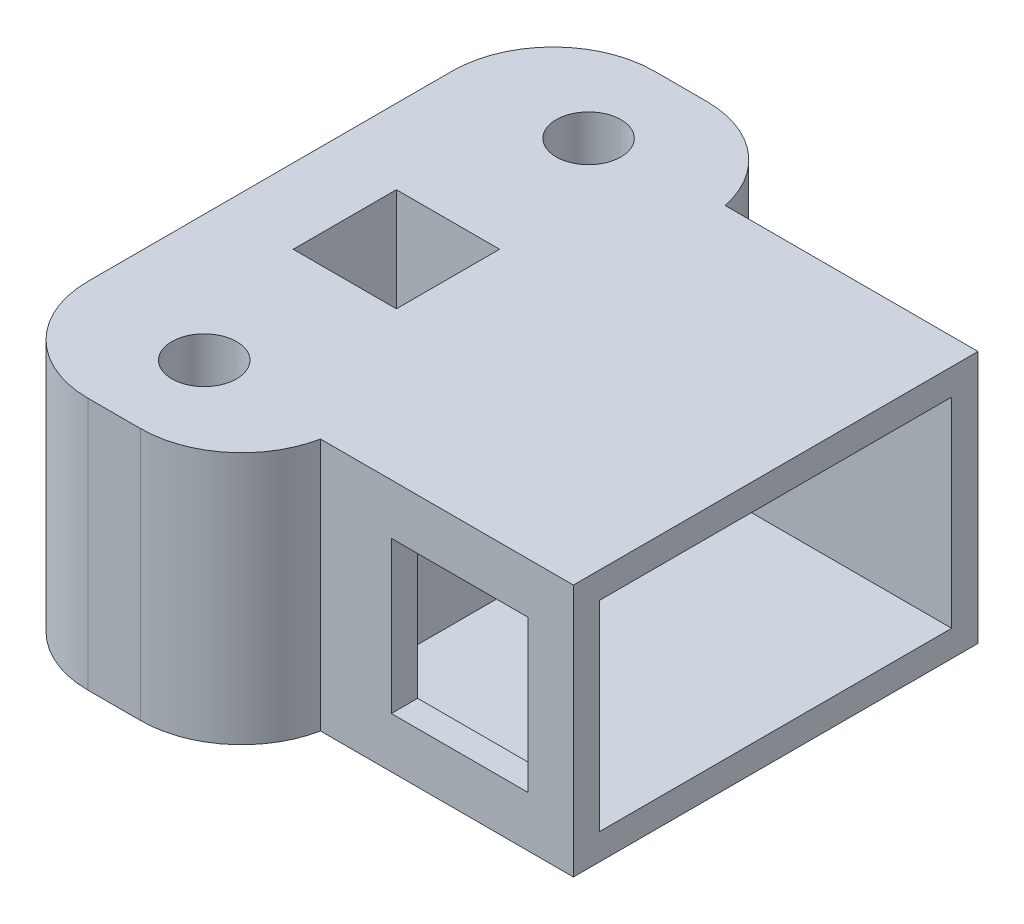
from build123d import *

# Parameters (mm, degrees)
BOSS_EXTRUDE2_DEPTH     = 25
SKETCH4_W               = 10.2
SKETCH4_H               = 10.2
CUT_EXTRUDE2_DEPTH      = 22
SKETCH5_R               = 3.2
CUT_EXTRUDE3_DEPTH      = 63.521996129
FILLET1_R               = 10
SKETCH8_W               = 34.8
SKETCH8_H               = 19.8
CUT_EXTRUDE6_DEPTH      = 25
CUT_EXTRUDE7_DEPTH      = 57.778164817
CUT_EXTRUDE7_DEPTH_BACK = 57.778164817
SKETCH9_R               = 1.6
CUT_EXTRUDE9_DEPTH      = 3.5
SKETCH12_R              = 3.531558014
CUT_EXTRUDE10_DEPTH     = 7
SKETCH13_W              = 13.5
SKETCH13_H              = 15
CUT_EXTRUDE11_DEPTH     = 73.014998438
SKETCH14_R              = 3.5
CUT_EXTRUDE12_DEPTH     = 3
SKETCH15_R              = 6.5
CUT_EXTRUDE13_DEPTH     = 6
BOSS_EXTRUDE3_DEPTH     = 0.5


with BuildPart() as part:
    # Sketch3 → Boss-Extrude2 (new body)
    with BuildSketch(Plane(origin=(0, 0, 0), x_dir=(1, 0, 0), z_dir=(0, 1, 0))):
        Polygon((0, -28), (0, 28), (25, 28), (25, 20), (50, 20), (50, -20), (25, -20), (25, -28), align=None)
    extrude(amount=BOSS_EXTRUDE2_DEPTH)

    # Sketch4 → Cut-Extrude2 (cut)
    with BuildSketch(Plane(origin=(0, 25, 0), x_dir=(1, 0, 0), z_dir=(0, 1, 0))):
        with Locations((12.5, 0)):
            Rectangle(SKETCH4_W, SKETCH4_H)
    extrude(amount=-CUT_EXTRUDE2_DEPTH, mode=Mode.SUBTRACT)

    # Sketch5 → Cut-Extrude3 (cut, through all)
    with BuildSketch(Plane(origin=(0, 25, 0), x_dir=(1, 0, 0), z_dir=(0, 1, 0))):
        with Locations(Location((12.5, 19, 0), (0, 0, 270))):
            Circle(SKETCH5_R)
        with Locations(Location((12.5, -19, 0), (0, 0, 270))):
            Circle(SKETCH5_R)
    extrude(amount=-CUT_EXTRUDE3_DEPTH, mode=Mode.SUBTRACT)

    # Fillet1
    # the kernel refuses this fillet: 10 mm, written as the material it takes off along each edge
    with BuildSketch(Plane(origin=(25, -24.494897428, 28), x_dir=(-1, 0, 0), z_dir=(0, 1, 0))) as fillet1_piece_1:
        with BuildLine():
            CenterArc((9.797958971, -10), FILLET1_R, 90, 78.463040967)
            Line((0, -8), (-0.195959179, -7.96))
            ThreePointArc((-0.195959179, -7.96), (-0.2, -4), (-0.2, 0))
            Line((-0.2, 0), (0, 0.2))
            Line((0, 0.2), (9.797958971, 0.2))
            Line((9.797958971, 0.2), (9.797958971, 0))
        make_face()
    extrude(amount=73.989794856, mode=Mode.SUBTRACT)
    with BuildSketch(Plane(origin=(0, -25, 28), x_dir=(0, 0, -1), z_dir=(0, 1, 0))) as fillet1_piece_2:
        with BuildLine():
            CenterArc((FILLET1_R, -FILLET1_R), FILLET1_R, 90, 90)
            Line((0, -FILLET1_R), (-FILLET1_R * 0.02, -FILLET1_R))
            Line((-FILLET1_R * 0.02, -FILLET1_R), (-FILLET1_R * 0.02, FILLET1_R * 0.02))
            Line((-FILLET1_R * 0.02, FILLET1_R * 0.02), (FILLET1_R, FILLET1_R * 0.02))
            Line((FILLET1_R, FILLET1_R * 0.02), (FILLET1_R, 0))
        make_face()
    extrude(amount=75, mode=Mode.SUBTRACT)
    with BuildSketch(Plane(origin=(25, -24.494897428, -28), x_dir=(-1, 0, 0), z_dir=(0, 1, 0))) as fillet1_piece_3:
        with BuildLine():
            CenterArc((9.797958971, 10), FILLET1_R, 191.536959033, 78.463040967)
            Line((0, 8), (-0.195959179, 7.96))
            ThreePointArc((-0.195959179, 7.96), (-0.2, 4), (-0.2, 0))
            Line((-0.2, 0), (0, -0.2))
            Line((0, -0.2), (9.797958971, -0.2))
            Line((9.797958971, -0.2), (9.797958971, 0))
        make_face()
    extrude(amount=73.989794856, mode=Mode.SUBTRACT)
    with BuildSketch(Plane(origin=(0, -25, -28), x_dir=(0, 0, 1), z_dir=(0, 1, 0))) as fillet1_piece_4:
        with BuildLine():
            CenterArc((FILLET1_R, FILLET1_R), FILLET1_R, 180, 90)
            Line((0, FILLET1_R), (-FILLET1_R * 0.02, FILLET1_R))
            Line((-FILLET1_R * 0.02, FILLET1_R), (-FILLET1_R * 0.02, -FILLET1_R * 0.02))
            Line((-FILLET1_R * 0.02, -FILLET1_R * 0.02), (FILLET1_R, -FILLET1_R * 0.02))
            Line((FILLET1_R, -FILLET1_R * 0.02), (FILLET1_R, 0))
        make_face()
    extrude(amount=75, mode=Mode.SUBTRACT)

    # Sketch8 → Cut-Extrude6 (cut)
    with BuildSketch(Plane(origin=(50, 0, 0), x_dir=(0, 0, -1), z_dir=(1, 0, 0))):
        with Locations((0, 12.5)):
            Rectangle(SKETCH8_W, SKETCH8_H)
    extrude(amount=-CUT_EXTRUDE6_DEPTH, mode=Mode.SUBTRACT)

    # Sketch9 → Cut-Extrude7 (cut, two sides: drawn at the far end of the back side and taken through both)
    with BuildSketch(Plane(origin=(7.4, 0, 0), x_dir=(0, 0, -1), z_dir=(1, 0, 0)).offset(-CUT_EXTRUDE7_DEPTH_BACK)):
        with Locations((-2.6, 19)):
            Circle(SKETCH9_R)
        with Locations((-2.6, 7)):
            Circle(SKETCH9_R)
    extrude(amount=CUT_EXTRUDE7_DEPTH + CUT_EXTRUDE7_DEPTH_BACK, mode=Mode.SUBTRACT)

    # Sketch11 → Cut-Extrude9 (cut)
    with BuildSketch(Plane(origin=(25, 0, 0), x_dir=(0, 0, -1), z_dir=(1, 0, 0))):
        Polygon((0.65, 19), (-0.975, 21.814582562), (-4.225, 21.814582562), (-5.85, 19), (-4.225, 16.185417438), (-0.975, 16.185417438), align=None)
        Polygon((0.65, 7), (-0.975, 9.814582562), (-4.225, 9.814582562), (-5.85, 7), (-4.225, 4.185417438), (-0.975, 4.185417438), align=None)
    extrude(amount=-CUT_EXTRUDE9_DEPTH, mode=Mode.SUBTRACT)

    # Sketch12 → Cut-Extrude10 (cut)
    with BuildSketch(Plane(origin=(25, 0, 0), x_dir=(0, 0, -1), z_dir=(1, 0, 0))):
        with Locations((2.9, 13)):
            Circle(SKETCH12_R)
    extrude(amount=-CUT_EXTRUDE10_DEPTH, mode=Mode.SUBTRACT)

    # Sketch13 → Cut-Extrude11 (cut, through all)
    with BuildSketch(Plane(origin=(0, 0, 17.4), x_dir=(-1, 0, 0), z_dir=(0, 0, -1))):
        with Locations((-38.75, 12.5)):
            Rectangle(SKETCH13_W, SKETCH13_H)
    extrude(amount=-CUT_EXTRUDE11_DEPTH, mode=Mode.SUBTRACT)

    # Sketch14 → Cut-Extrude12 (cut)
    with BuildSketch(Plane.ZY):
        with Locations((2.6, 7)):
            Circle(SKETCH14_R)
        with Locations((2.6, 19)):
            Circle(SKETCH14_R)
    extrude(amount=-CUT_EXTRUDE12_DEPTH, mode=Mode.SUBTRACT)

    # Sketch15 → Cut-Extrude13 (cut)
    with BuildSketch(Plane.XZ):
        with Locations(Location((12.5, 19, 0), (0, 0, 270))):
            Circle(SKETCH15_R)
        with Locations(Location((12.5, -19, 0), (0, 0, 270))):
            Circle(SKETCH15_R)
    extrude(amount=-CUT_EXTRUDE13_DEPTH, mode=Mode.SUBTRACT)

    # Sketch16 → Boss-Extrude3 (add)
    # profile 1 of 8: a face of its own
    with BuildSketch(Plane(origin=(0, 0, -20), x_dir=(-1, 0, 0), z_dir=(0, 0, -1))):
        with BuildLine():
            Line((-46.301312659, 3.974358974), (-46.301312659, 5.194310897))
            add(Edge.make_bspline(
                [(-46.301312659, 5.194310897), (-46.300906723, 5.273780528), (-46.300123161, 5.427177505), (-46.290439008, 5.648902168), (-46.273392955, 5.853696496), (-46.251992114, 6.041502257), (-46.222462873, 6.211350778), (-46.187702513, 6.364180946), (-46.146753737, 6.500187073), (-46.080956899, 6.656885624), (-45.980707358, 6.833505142), (-45.824792028, 7.018065932), (-45.640333871, 7.182460284), (-45.42296905, 7.318284049), (-45.179865608, 7.430294181), (-44.910785825, 7.507279475), (-44.619494501, 7.556529634), (-44.417377565, 7.561522462), (-44.312931249, 7.564102564)],
                knots=[0, 0, 0, 0, 1.065351643, 2.056404681, 2.974375476, 3.820029707, 4.589591458, 5.284251435, 5.920493348, 6.490730355, 7.560220515, 8.628112351, 9.715733223, 10.859576442, 12.051334947, 13.292576679, 14.60090699, 16, 16, 16, 16], degree=3))
            add(Edge.make_bspline(
                [(-44.312931249, 7.564102564), (-44.254470366, 7.562957854), (-44.139680568, 7.56071018), (-43.971520767, 7.545080305), (-43.810838351, 7.519905079), (-43.657386335, 7.48512694), (-43.511220807, 7.439314704), (-43.373742713, 7.380622693), (-43.242187237, 7.315799781), (-43.120391561, 7.237441126), (-43.005713418, 7.152613532), (-42.89943206, 7.059927532), (-42.804498314, 6.957564185), (-42.715212063, 6.850856566), (-42.638638036, 6.733942112), (-42.567486595, 6.61218704), (-42.507105699, 6.481572945), (-42.475245151, 6.390244064), (-42.459165224, 6.344150641)],
                knots=[0, 0, 0, 0, 1.175790861, 2.308702621, 3.39375308, 4.445126599, 5.470926192, 6.469657361, 7.449311417, 8.416982597, 9.377824743, 10.317082629, 11.248164886, 12.183509279, 13.111786851, 14.055176252, 15.018453065, 16, 16, 16, 16], degree=3))
            add(Edge.make_bspline(
                [(-42.459165224, 6.344150641), (-42.450237988, 6.313894266), (-42.430927397, 6.2484464), (-42.411369801, 6.13980018), (-42.393176064, 6.014944161), (-42.377691973, 5.873252419), (-42.367126075, 5.714177513), (-42.358937533, 5.538392885), (-42.352896001, 5.345326663), (-42.352698116, 5.211142971), (-42.352594711, 5.141025641)],
                knots=[0, 0, 0, 0, 0.62455842, 1.350988544, 2.183881829, 3.124681218, 4.173690175, 5.341783345, 6.610955979, 8, 8, 8, 8], degree=3))
            Line((-42.352594711, 5.141025641), (-39.301312659, 5.141025641))
            Line((-39.301312659, 5.141025641), (-39.301312659, 3.974358974))
            Line((-39.301312659, 3.974358974), (-46.301312659, 3.974358974))
        make_face()
        with BuildLine():
            Line((-43.609004967, 5.141025641), (-43.609004967, 5.487379808))
            add(Edge.make_bspline(
                [(-43.609004967, 5.487379808), (-43.609533517, 5.550043141), (-43.610509413, 5.665742661), (-43.624081773, 5.823761537), (-43.645133485, 5.951287764), (-43.675462284, 6.052539094), (-43.720728125, 6.131961927), (-43.773994489, 6.200351454), (-43.840718665, 6.258549286), (-43.917141463, 6.309213848), (-44.004849205, 6.347402777), (-44.099888091, 6.378143387), (-44.204410118, 6.394316632), (-44.276892556, 6.396373446), (-44.314333493, 6.397435897)],
                knots=[0, 0, 0, 0, 1.685929749, 3.112845276, 4.262652622, 5.161635267, 5.938651418, 6.70871335, 7.483792692, 8.310626063, 9.166328046, 10.049508244, 10.992469874, 12, 12, 12, 12], degree=3))
            add(Edge.make_bspline(
                [(-44.314333493, 6.397435897), (-44.347072844, 6.396508231), (-44.41041432, 6.394713456), (-44.502322705, 6.384339142), (-44.586745036, 6.362782453), (-44.664523487, 6.334319928), (-44.737171578, 6.300548511), (-44.800076932, 6.253730943), (-44.859085335, 6.202913892), (-44.890394853, 6.16154853), (-44.906080288, 6.140825321)],
                knots=[0, 0, 0, 0, 1.171126782, 2.265802336, 3.299570412, 4.277792995, 5.227171901, 6.150138764, 7.07325697, 8, 8, 8, 8], degree=3))
            add(Edge.make_bspline(
                [(-44.906080288, 6.140825321), (-44.917315471, 6.123803381), (-44.941014973, 6.087897295), (-44.968324282, 6.02522358), (-44.992077011, 5.953396055), (-45.01141131, 5.871716403), (-45.02661582, 5.779897876), (-45.03790475, 5.678338069), (-45.042673861, 5.56641534), (-45.04413631, 5.488783749), (-45.044902403, 5.448116987)],
                knots=[0, 0, 0, 0, 0.682307748, 1.439260232, 2.281200188, 3.215652619, 4.248121713, 5.398252977, 6.63709314, 8, 8, 8, 8], degree=3))
            Line((-45.044902403, 5.448116987), (-45.044902403, 5.141025641))
            Line((-45.044902403, 5.141025641), (-43.609004967, 5.141025641))
        make_face(mode=Mode.SUBTRACT)
    # profile 2 of 8: a face of its own
    with BuildSketch(Plane(origin=(0, 0, -20), x_dir=(-1, 0, 0), z_dir=(0, 0, -1))):
        with BuildLine():
            Line((-46.301312659, 8.730769231), (-46.301312659, 9.897435897))
            Line((-46.301312659, 9.897435897), (-41.74682548, 9.897435897))
            add(Edge.make_bspline(
                [(-41.74682548, 9.897435897), (-41.699610069, 9.897631459), (-41.608431383, 9.898009112), (-41.477580076, 9.902919777), (-41.35681022, 9.907283398), (-41.247544885, 9.91803565), (-41.148086082, 9.927965349), (-41.060386426, 9.944158179), (-40.982821196, 9.960043911), (-40.895236543, 9.9862702), (-40.79750303, 10.027113705), (-40.692978514, 10.09091099), (-40.599567616, 10.167289149), (-40.521923465, 10.259273054), (-40.455838883, 10.361021253), (-40.411483138, 10.476152962), (-40.382006941, 10.599868995), (-40.379510613, 10.686252482), (-40.378235736, 10.73036859)],
                knots=[0, 0, 0, 0, 1.240209945, 2.394995834, 3.439840725, 4.413658892, 5.278763124, 6.06402444, 6.75524026, 7.357397746, 8.463435755, 9.526873651, 10.564478676, 11.617945731, 12.677406551, 13.735372114, 14.84345292, 16, 16, 16, 16], degree=3))
            add(Edge.make_bspline(
                [(-40.378235736, 10.73036859), (-40.379890302, 10.777297102), (-40.383122223, 10.868964183), (-40.415117985, 11.000694308), (-40.466263174, 11.122729104), (-40.537840668, 11.23261824), (-40.625074164, 11.329352097), (-40.723651615, 11.411303817), (-40.833484107, 11.477576717), (-40.936119519, 11.516664929), (-41.02845639, 11.543323203), (-41.113270872, 11.557313248), (-41.211427687, 11.5713521), (-41.324021559, 11.584517029), (-41.451343585, 11.592078156), (-41.593016868, 11.597273401), (-41.74866634, 11.601957981), (-41.857131325, 11.60235636), (-41.913692467, 11.602564103)],
                knots=[0, 0, 0, 0, 1.116580344, 2.181054897, 3.209245992, 4.256624867, 5.289871485, 6.302438345, 7.301498364, 8.331558076, 8.909905092, 9.58935648, 10.376970716, 11.273675664, 12.289484312, 13.415359509, 14.652189745, 16, 16, 16, 16], degree=3))
            Line((-41.913692467, 11.602564103), (-46.301312659, 11.602564103))
            Line((-46.301312659, 11.602564103), (-46.301312659, 12.769230769))
            Line((-46.301312659, 12.769230769), (-42.125431249, 12.769230769))
            add(Edge.make_bspline(
                [(-42.125431249, 12.769230769), (-42.040823473, 12.769170319), (-41.878130969, 12.76905408), (-41.644440887, 12.762400176), (-41.430748387, 12.756411984), (-41.2375754, 12.74568416), (-41.064744676, 12.729384183), (-40.911567639, 12.713865746), (-40.778685846, 12.692968479), (-40.62791048, 12.661309278), (-40.453970107, 12.608571377), (-40.253980186, 12.521546667), (-40.056675962, 12.41350305), (-39.867930021, 12.282629389), (-39.690357819, 12.137932772), (-39.535587722, 11.978176999), (-39.406380053, 11.806515619), (-39.301282757, 11.623985792), (-39.220273493, 11.427383174), (-39.163780401, 11.216226248), (-39.127345741, 10.990104965), (-39.123699302, 10.834281061), (-39.12182548, 10.754206731)],
                knots=[0, 0, 0, 0, 1.230165497, 2.365488278, 3.399098432, 4.338575005, 5.177867348, 5.923149775, 6.576805705, 7.132657403, 8.162506846, 9.212873587, 10.298787108, 11.427990605, 12.547931868, 13.624596859, 14.653571313, 15.664315956, 16.67907422, 17.735929368, 18.836546041, 20, 20, 20, 20], degree=3))
            add(Edge.make_bspline(
                [(-39.12182548, 10.754206731), (-39.122837644, 10.700871533), (-39.124831648, 10.595799062), (-39.142549557, 10.441234945), (-39.1688636, 10.291631141), (-39.206209064, 10.146787255), (-39.257462276, 10.008000142), (-39.31782245, 9.874402672), (-39.38811644, 9.74528207), (-39.497621714, 9.584148955), (-39.650095726, 9.398541456), (-39.860467565, 9.208531654), (-40.092083716, 9.051265158), (-40.305697877, 8.948175372), (-40.496269136, 8.885454063), (-40.662279837, 8.844179037), (-40.850261443, 8.807325532), (-41.061646317, 8.780670787), (-41.295470794, 8.758412685), (-41.552177865, 8.741667902), (-41.831350316, 8.731931735), (-42.024929029, 8.731166517), (-42.125431249, 8.730769231)],
                knots=[0, 0, 0, 0, 0.774800378, 1.526387719, 2.257847792, 2.981093763, 3.696611806, 4.404904008, 5.110160869, 5.829793705, 7.233438306, 8.589521843, 9.934623106, 11.289617529, 12.019909815, 12.846900275, 13.774045006, 14.801908727, 15.941419467, 17.187082568, 18.539589166, 20, 20, 20, 20], degree=3))
            Line((-42.125431249, 8.730769231), (-46.301312659, 8.730769231))
        make_face()
    # profile 3 of 8: a face of its own
    with BuildSketch(Plane(origin=(0, 0, -20), x_dir=(-1, 0, 0), z_dir=(0, 0, -1))):
        Polygon((-46.301312659, 14.205128205), (-46.301312659, 15.371794872), (-40.557722916, 15.371794872), (-40.557722916, 17.076923077), (-39.301312659, 17.076923077), (-39.301312659, 14.205128205), align=None)
    # profile 4 of 8: a face of its own
    with BuildSketch(Plane(origin=(0, 0, -20), x_dir=(-1, 0, 0), z_dir=(0, 0, -1))):
        Polygon((-46.301312659, 17.974358974), (-46.301312659, 19.141025641), (-40.557722916, 19.141025641), (-40.557722916, 20.846153846), (-39.301312659, 20.846153846), (-39.301312659, 17.974358974), align=None)
    # profile 5 of 8: a face of its own
    with BuildSketch(Plane(origin=(0, 0, -20), x_dir=(-1, 0, 0), z_dir=(0, 0, -1))):
        Polygon((-33.185928044, 3.480769231), (-33.185928044, 4.647435897), (-30.493620352, 4.647435897), (-30.493620352, 6.711538462), (-33.185928044, 6.711538462), (-33.185928044, 7.878205128), (-26.185928044, 7.878205128), (-26.185928044, 6.711538462), (-29.237210095, 6.711538462), (-29.237210095, 4.647435897), (-26.185928044, 4.647435897), (-26.185928044, 3.480769231), align=None)
    # profile 6 of 8: a face of its own
    with BuildSketch(Plane(origin=(0, 0, -20), x_dir=(-1, 0, 0), z_dir=(0, 0, -1))):
        Polygon((-33.185928044, 9.224358974), (-33.185928044, 12.455128205), (-31.929517788, 12.455128205), (-31.929517788, 10.391025641), (-30.583363942, 10.391025641), (-30.583363942, 12.455128205), (-29.326953685, 12.455128205), (-29.326953685, 10.391025641), (-27.442338301, 10.391025641), (-27.442338301, 12.455128205), (-26.185928044, 12.455128205), (-26.185928044, 9.224358974), align=None)
    # profile 7 of 8: a face of its own
    with BuildSketch(Plane(origin=(0, 0, -20), x_dir=(-1, 0, 0), z_dir=(0, 0, -1))):
        with BuildLine():
            Line((-33.185928044, 13.621794872), (-33.185928044, 14.872596154))
            add(Edge.make_bspline(
                [(-33.185928044, 14.872596154), (-33.185574598, 14.954874713), (-33.184891525, 15.113886782), (-33.174511766, 15.342986592), (-33.160114786, 15.554051864), (-33.137263615, 15.746219219), (-33.110567324, 15.920203296), (-33.074787612, 16.075411701), (-33.03582831, 16.213047447), (-32.971658094, 16.370388594), (-32.871558664, 16.547401939), (-32.71659215, 16.734697211), (-32.529642382, 16.901501598), (-32.3104305, 17.043264127), (-32.064253975, 17.159883596), (-31.793591647, 17.242229084), (-31.502266113, 17.292001492), (-31.301048583, 17.298129788), (-31.197546634, 17.301282051)],
                knots=[0, 0, 0, 0, 1.087892061, 2.102467149, 3.032077607, 3.884603215, 4.660928175, 5.358154853, 5.989838047, 6.549943204, 7.60177036, 8.664617389, 9.750224514, 10.902244484, 12.104963233, 13.340537084, 14.632029737, 16, 16, 16, 16], degree=3))
            add(Edge.make_bspline(
                [(-31.197546634, 17.301282051), (-31.142363508, 17.300597998), (-31.034146138, 17.299256528), (-30.875296033, 17.285082009), (-30.723236244, 17.260795343), (-30.577674822, 17.229424991), (-30.439287329, 17.18720487), (-30.308517091, 17.134514457), (-30.183391946, 17.075260444), (-30.066186231, 17.003889377), (-29.955628622, 16.924612111), (-29.85235255, 16.835015164), (-29.755439942, 16.736857165), (-29.665306588, 16.628856046), (-29.584138248, 16.509744226), (-29.508584408, 16.382445197), (-29.439104077, 16.245880319), (-29.400109995, 16.149881647), (-29.380238942, 16.100961538)],
                knots=[0, 0, 0, 0, 1.132672757, 2.221238183, 3.270347143, 4.292425958, 5.275892281, 6.236337612, 7.184820322, 8.114625169, 9.049417719, 9.974705671, 10.917882618, 11.878663443, 12.858189505, 13.873579724, 14.916394281, 16, 16, 16, 16], degree=3))
            Line((-29.380238942, 16.100961538), (-26.185928044, 17.615384615))
            Line((-26.185928044, 17.615384615), (-26.185928044, 16.290264423))
            Line((-26.185928044, 16.290264423), (-29.237210095, 14.843149038))
            Line((-29.237210095, 14.843149038), (-29.237210095, 14.788461538))
            Line((-29.237210095, 14.788461538), (-26.185928044, 14.788461538))
            Line((-26.185928044, 14.788461538), (-26.185928044, 13.621794872))
            Line((-26.185928044, 13.621794872), (-33.185928044, 13.621794872))
        make_face()
        with BuildLine():
            Line((-30.493620352, 14.788461538), (-30.493620352, 15.155849359))
            add(Edge.make_bspline(
                [(-30.493620352, 15.155849359), (-30.494298493, 15.200723626), (-30.495599132, 15.286790044), (-30.501541942, 15.410495301), (-30.516039124, 15.522754374), (-30.534344186, 15.624269324), (-30.555349913, 15.715966609), (-30.585449444, 15.795817195), (-30.618363163, 15.865774486), (-30.671357163, 15.942975373), (-30.755299244, 16.023852507), (-30.885335364, 16.090058234), (-31.041535337, 16.128985642), (-31.154298641, 16.132658605), (-31.214373557, 16.134615385)],
                knots=[0, 0, 0, 0, 1.14443165, 2.194958024, 3.155864406, 4.02787753, 4.825710302, 5.549708663, 6.200008757, 6.791751392, 7.929772656, 9.129352395, 10.470655706, 12, 12, 12, 12], degree=3))
            add(Edge.make_bspline(
                [(-31.214373557, 16.134615385), (-31.251405667, 16.133294899), (-31.323211358, 16.130734462), (-31.427274878, 16.110060851), (-31.524763774, 16.078843301), (-31.612763282, 16.031692891), (-31.692134822, 15.975828164), (-31.760041647, 15.909642642), (-31.815096657, 15.83393724), (-31.862086625, 15.746701504), (-31.894119174, 15.634840245), (-31.914335515, 15.491641495), (-31.928108024, 15.312692701), (-31.929021215, 15.181120988), (-31.929517788, 15.109575321)],
                knots=[0, 0, 0, 0, 0.9241003, 1.791841178, 2.640927318, 3.471185814, 4.274581995, 5.058835706, 5.827024317, 6.605084504, 7.520888769, 8.714677486, 10.213517293, 12, 12, 12, 12], degree=3))
            Line((-31.929517788, 15.109575321), (-31.929517788, 14.788461538))
            Line((-31.929517788, 14.788461538), (-30.493620352, 14.788461538))
        make_face(mode=Mode.SUBTRACT)
    # profile 8 of 8: a face of its own
    with BuildSketch(Plane(origin=(0, 0, -20), x_dir=(-1, 0, 0), z_dir=(0, 0, -1))):
        Polygon((-33.185928044, 18.557692308), (-33.185928044, 21.788461538), (-31.929517788, 21.788461538), (-31.929517788, 19.724358974), (-30.583363942, 19.724358974), (-30.583363942, 21.788461538), (-29.326953685, 21.788461538), (-29.326953685, 19.724358974), (-27.442338301, 19.724358974), (-27.442338301, 21.788461538), (-26.185928044, 21.788461538), (-26.185928044, 18.557692308), align=None)
    extrude(amount=BOSS_EXTRUDE3_DEPTH)


solid = part.part
